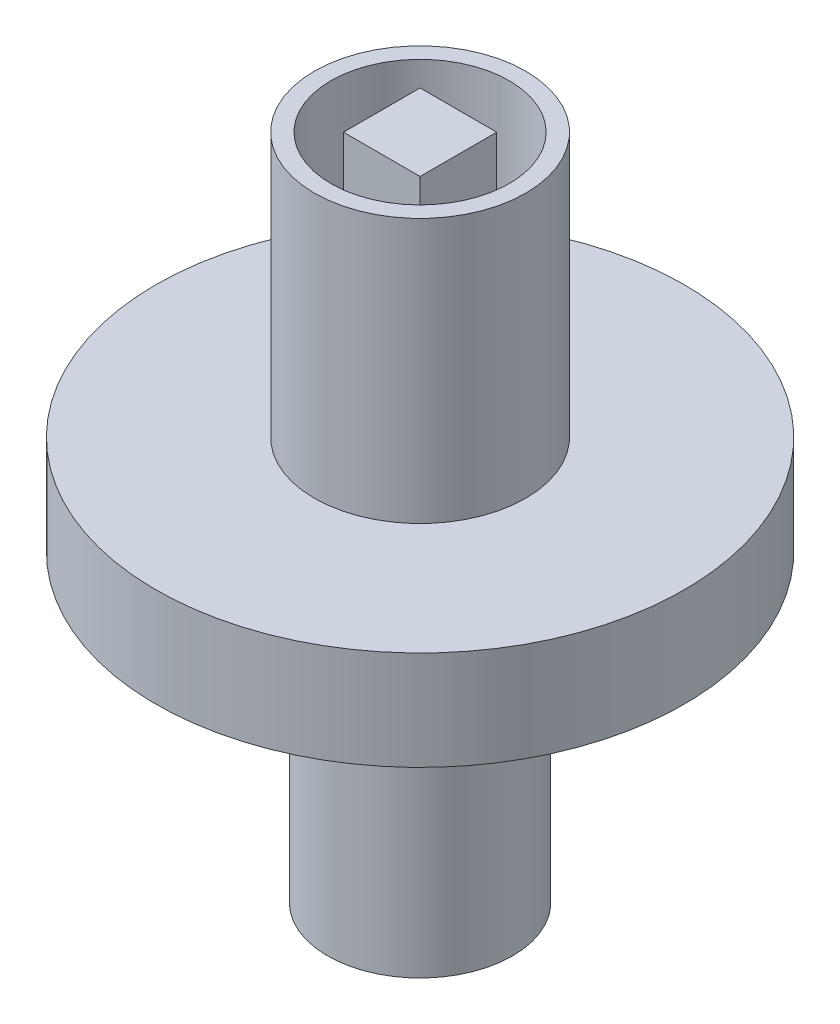
from build123d import *

# Parameters (mm, degrees)
SKETCH3_R           = 6.75
CUT_EXTRUDE1_DEPTH  = 15
SKETCH4_W           = 5.8
SKETCH4_H           = 5.8
BOSS_EXTRUDE1_DEPTH = 15
SKETCH6_R           = 7
BOSS_EXTRUDE2_DEPTH = 23
SKETCH7_R           = 3.5
CUT_EXTRUDE2_DEPTH  = 15
CUT_EXTRUDE3_DEPTH  = 15


with BuildPart() as part:
    # Sketch2 → Revolve2 (revolve)
    with BuildSketch(Plane.XY):
        Polygon((20, 0), (20, 7.5), (8, 7.5), (8, 27.5), (0, 27.5), (0, 0), align=None)
    revolve(axis=Axis((0, 96.27972973, 0), (0, -1, 0)))

    # Sketch3 → Cut-Extrude1 (cut)
    with BuildSketch(Plane(origin=(0, 27.5, 0), x_dir=(1, 0, 0), z_dir=(0, 1, 0))):
        Circle(SKETCH3_R)
    extrude(amount=-CUT_EXTRUDE1_DEPTH, mode=Mode.SUBTRACT)

    # Sketch4 → Boss-Extrude1 (add)
    with BuildSketch(Plane(origin=(0, 12.5, 0), x_dir=(1, 0, 0), z_dir=(0, 1, 0))):
        with Locations((0.004761868, -0.002625461)):
            Rectangle(SKETCH4_W, SKETCH4_H)
    extrude(amount=BOSS_EXTRUDE1_DEPTH)

    # Sketch6 → Boss-Extrude2 (add)
    with BuildSketch(Plane.XZ):
        Circle(SKETCH6_R)
    extrude(amount=BOSS_EXTRUDE2_DEPTH)

    # Sketch7 → Cut-Extrude2 (cut)
    with BuildSketch(Plane.XZ.offset(23)):
        Circle(SKETCH7_R)
    extrude(amount=-CUT_EXTRUDE2_DEPTH, mode=Mode.SUBTRACT)

    # Sketch8 → Cut-Extrude3 (cut)
    with BuildSketch(Plane.XZ.offset(23)):
        Polygon((-5.3, 1.5), (-1.5, 1.5), (-1.5, 5.3), (1.5, 5.3), (1.5, 1.5), (5.3, 1.5), (5.3, -1.5), (1.5, -1.5), (1.5, -5.3), (-1.5, -5.3), (-1.5, -1.5), (-5.3, -1.5), align=None)
    extrude(amount=-CUT_EXTRUDE3_DEPTH, mode=Mode.SUBTRACT)


solid = part.part
